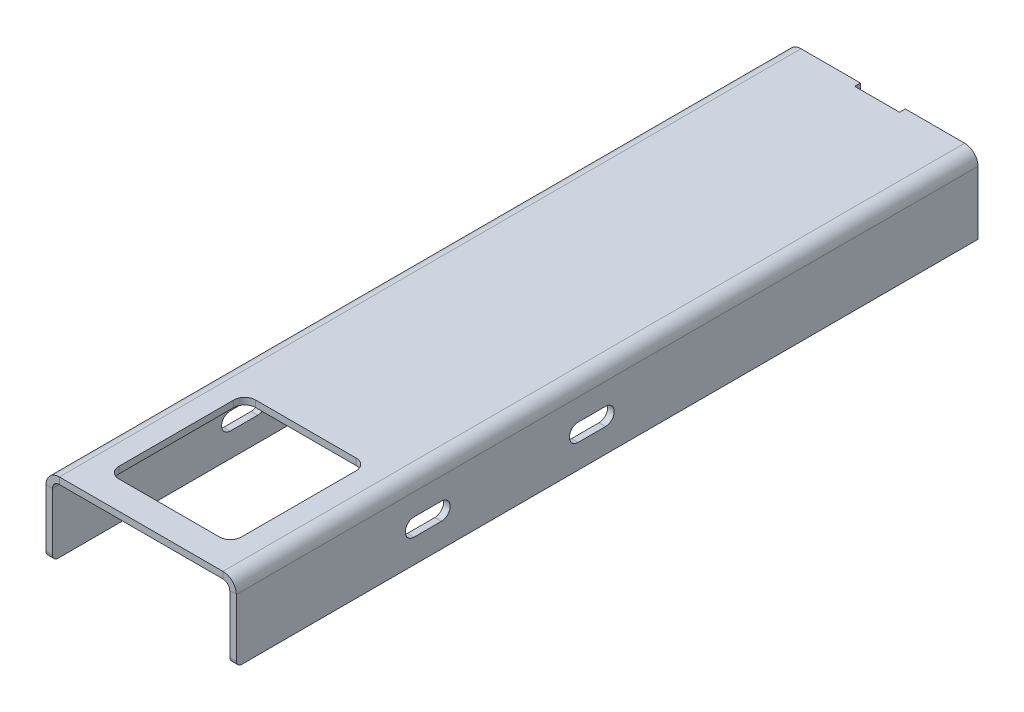
from build123d import *

# Parameters (mm, degrees)
BOSS_EXTRUDE1_DEPTH        = 955
FLATTEN_BENDS1_OUTLINE_W   = 6
FLATTEN_BENDS1_OUTLINE_H   = 64
FLATTEN_BENDS1_DEPTH       = 955
FLATTEN_BENDS1_2_OUTLINE_W = 59.495264307
FLATTEN_BENDS1_2_OUTLINE_H = 6
FLATTEN_BENDS1_2_DEPTH     = 955
PROCESS_BENDS1_DEPTH       = 955
PROCESS_BENDS1_2_DEPTH     = 955
BOSS_EXTRUDE2_DEPTH        = 6
EDGE_FLANGE1_DEPTH         = 206.725155702
EDGE_FLANGE1_BEND_DEPTH    = 206.725155702
CUT_EXTRUDE1_DEPTH         = 15
CUT_EXTRUDE2_START         = -25.25
CUT_EXTRUDE2_DEPTH         = 25.25
SKETCH17_W                 = 20.5
SKETCH17_H                 = 7
CUT_EXTRUDE3_DEPTH         = 10
FILLET1_R                  = 10
SKETCH18_W                 = 41
SKETCH18_H                 = 5.25
CUT_EXTRUDE4_DEPTH         = 10
SKETCH19_W                 = 174
SKETCH19_H                 = 480
CUT_EXTRUDE5_DEPTH         = 1164.457508004
FILLET2_R                  = 5
CUT_EXTRUDE6_DEPTH         = 704.546245741


# Read off the part's stored shape, not the designer's step: Flatten-Bends1, Process-Bends1, Cut-Extrude2
# Sheet-metal steps are written as plain solids
with BuildPart() as part:
    # Sketch1 → Boss-Extrude1 (new body)
    with BuildSketch(Plane.XY):
        Polygon((-87, -70), (-87, 0), (87, 0), (87, -70), (81, -70), (81, -6), (-81, -6), (-81, -70), align=None)
    extrude(amount=BOSS_EXTRUDE1_DEPTH)

    # Flatten-Bends1 outline → Flatten-Bends1 (cut)
    with BuildSketch(Plane.XY):
        with Locations((-84, -38)):
            Rectangle(FLATTEN_BENDS1_OUTLINE_W, FLATTEN_BENDS1_OUTLINE_H)
        with Locations((84, -38)):
            Rectangle(FLATTEN_BENDS1_OUTLINE_W, FLATTEN_BENDS1_OUTLINE_H)
    extrude(amount=FLATTEN_BENDS1_DEPTH, mode=Mode.SUBTRACT)

    # Flatten-Bends1 2 outline → Flatten-Bends1 2 (add)
    with BuildSketch(Plane.XY):
        with Locations((-116.747632154, -3)):
            Rectangle(FLATTEN_BENDS1_2_OUTLINE_W, FLATTEN_BENDS1_2_OUTLINE_H)
        with Locations((116.747632154, -3)):
            Rectangle(FLATTEN_BENDS1_2_OUTLINE_W, FLATTEN_BENDS1_2_OUTLINE_H)
    extrude(amount=FLATTEN_BENDS1_2_DEPTH)

    # Process-Bends1 outline → Process-Bends1 (cut)
    with BuildSketch(Plane.XY):
        with BuildLine():
            ThreePointArc((74.8, 0), (80.849793384, -1.60566189), (85.307140429, -6))
            Line((85.307140429, -6), (146.495264307, -6))
            Line((146.495264307, -6), (146.495264307, 0))
            Line((146.495264307, 0), (74.8, 0))
        make_face()
        with BuildLine():
            Line((-146.495264307, -6), (-85.307140429, -6))
            ThreePointArc((-85.307140429, -6), (-80.849793384, -1.60566189), (-74.8, 0))
            Line((-74.8, 0), (-146.495264307, 0))
            Line((-146.495264307, 0), (-146.495264307, -6))
        make_face()
    extrude(amount=PROCESS_BENDS1_DEPTH, mode=Mode.SUBTRACT)

    # Process-Bends1 2 outline → Process-Bends1 2 (add)
    with BuildSketch(Plane.XY):
        with BuildLine():
            Line((81, -12.2), (81, -70))
            Line((81, -70), (87, -70))
            Line((87, -70), (87, -12.2))
            ThreePointArc((87, -12.2), (86.569178247, -8.986521607), (85.307140429, -6))
            Line((85.307140429, -6), (74.8, -6))
            ThreePointArc((74.8, -6), (79.184062043, -7.815937957), (81, -12.2))
        make_face()
        with BuildLine():
            Line((-87, -70), (-81, -70))
            Line((-81, -70), (-81, -12.2))
            ThreePointArc((-81, -12.2), (-79.184062043, -7.815937957), (-74.8, -6))
            Line((-74.8, -6), (-85.307140429, -6))
            ThreePointArc((-85.307140429, -6), (-86.569178247, -8.986521607), (-87, -12.2))
            Line((-87, -12.2), (-87, -70))
        make_face()
    extrude(amount=PROCESS_BENDS1_2_DEPTH)

    # Sketch8 → Boss-Extrude2 (add)
    with BuildSketch(Plane(origin=(0, 0, 0), x_dir=(1, 0, 0), z_dir=(0, 1, 0))):
        Polygon((-74.8, -955), (-22.5, -1155), (22.5, -1155), (74.8, -955), align=None)
    extrude(amount=-BOSS_EXTRUDE2_DEPTH)

    # Edge-Flange1 section (across the edge) → Edge-Flange1 (add)
    with BuildSketch(Plane(origin=(80.798302412, -6, 956.568556081), x_dir=(-0.9674681309145718, -3.491481338843133e-15, -0.25299291623416037), z_dir=(-0.25299291623416037, 0, 0.9674681309145718))):
        with BuildLine():
            Line((-6, 6.2), (-6, 64))
            Line((-6, 64), (0, 64))
            Line((0, 64), (0, 6.2))
            ThreePointArc((0, 6.2), (1.815937957, 1.815937957), (6.2, 0))
            Line((6.2, 0), (6.2, -6))
            ThreePointArc((6.2, -6), (-2.42670273, -2.42670273), (-6, 6.2))
        make_face()
    extrude(amount=EDGE_FLANGE1_DEPTH)

    # Edge-Flange1 section 2 (across the edge) → Edge-Flange1 bend (add)
    with BuildSketch(Plane(origin=(-28.498302412, -6, 1156.568556081), x_dir=(0.9674681309145718, -3.4914813388431337e-15, -0.25299291623416087), z_dir=(-0.25299291623416087, 0, -0.9674681309145718))):
        with BuildLine():
            Line((-6, 6.2), (-6, 64))
            Line((-6, 64), (0, 64))
            Line((0, 64), (0, 6.2))
            ThreePointArc((0, 6.2), (1.815937957, 1.815937957), (6.2, 0))
            Line((6.2, 0), (6.2, -6))
            ThreePointArc((6.2, -6), (-2.42670273, -2.42670273), (-6, 6.2))
        make_face()
    extrude(amount=EDGE_FLANGE1_BEND_DEPTH)

    # Sketch15 → Cut-Extrude1 (cut)
    with BuildSketch(Plane(origin=(0, 0, 0), x_dir=(1, 0, 0), z_dir=(0, 1, 0))):
        with BuildLine():
            Line((46, -652.45), (-46, -652.45))
            ThreePointArc((-46, -652.45), (-53.071067812, -649.521067812), (-56, -642.45))
            Line((-56, -642.45), (-56, -537.45))
            ThreePointArc((-56, -537.45), (-53.071067812, -530.378932188), (-46, -527.45))
            Line((-46, -527.45), (46, -527.45))
            ThreePointArc((46, -527.45), (53.071067812, -530.378932188), (56, -537.45))
            Line((56, -537.45), (56, -642.45))
            ThreePointArc((56, -642.45), (53.071067812, -649.521067812), (46, -652.45))
        make_face()
    extrude(amount=-CUT_EXTRUDE1_DEPTH, mode=Mode.SUBTRACT)

    # Cut-Extrude2 outline → Cut-Extrude2 (cut)
    with BuildSketch(Plane.XZ.offset(70).offset(CUT_EXTRUDE2_START)):
        Polygon((-53.676734498, 1084), (-47.871925712, 1082.482042503), (-45.644479827, 1091), (-51.449288612, 1092.517957497), align=None)
        Polygon((45.644479827, 1091), (47.871925713, 1082.482042503), (53.676734498, 1084), (51.449288612, 1092.517957497), align=None)
    extrude(amount=CUT_EXTRUDE2_DEPTH, mode=Mode.SUBTRACT)

    # Sketch17 → Cut-Extrude3 (cut)
    with BuildSketch(Plane.XZ.offset(6)):
        with Locations((0, 1087.5)):
            Rectangle(SKETCH17_W, SKETCH17_H)
    extrude(amount=-CUT_EXTRUDE3_DEPTH, mode=Mode.SUBTRACT)

    # Fillet1
    fillet1_edges = [part.edges().sort_by_distance(p)[0] for p in [
        (31.400706804, -70, 1157.327534829),
        (-31.400706804, -70, 1157.327534829),
    ]]
    fillet(fillet1_edges, radius=FILLET1_R)

    # Sketch18 → Cut-Extrude4 (cut)
    with BuildSketch(Plane(origin=(0, 0, 0), x_dir=(1, 0, 0), z_dir=(0, 1, 0))):
        with Locations((0, -2.625)):
            Rectangle(SKETCH18_W, SKETCH18_H)
    extrude(amount=-CUT_EXTRUDE4_DEPTH, mode=Mode.SUBTRACT)

    # Sketch19 → Cut-Extrude5 (cut, through all)
    with BuildSketch(Plane(origin=(0, 0, 0), x_dir=(1, 0, 0), z_dir=(0, 1, 0))):
        with Locations((0, -918.086513578)):
            Rectangle(SKETCH19_W, SKETCH19_H)
    extrude(amount=-CUT_EXTRUDE5_DEPTH, mode=Mode.SUBTRACT)

    # Fillet2
    fillet2_edges = [part.edges().sort_by_distance(p)[0] for p in [
        (84, -70, 678.086513578),
        (-84, -70, 678.086513578),
    ]]
    fillet(fillet2_edges, radius=FILLET2_R)

    # Sketch20 → Cut-Extrude6 (cut, through all)
    with BuildSketch(Plane.ZY.offset(87)):
        with BuildLine():
            Line((490.586513578, -32), (515.586513578, -32))
            ThreePointArc((515.586513578, -32), (523.586513578, -40), (515.586513578, -48))
            Line((515.586513578, -48), (490.586513578, -48))
            ThreePointArc((490.586513578, -48), (482.586513578, -40), (490.586513578, -32))
        make_face()
        with BuildLine():
            Line((365.586513578, -32), (340.586513578, -32))
            ThreePointArc((340.586513578, -32), (332.586513578, -40), (340.586513578, -48))
            Line((340.586513578, -48), (365.586513578, -48))
            ThreePointArc((365.586513578, -48), (373.586513578, -40), (365.586513578, -32))
        make_face()
    extrude(amount=-CUT_EXTRUDE6_DEPTH, mode=Mode.SUBTRACT)


solid = part.part
